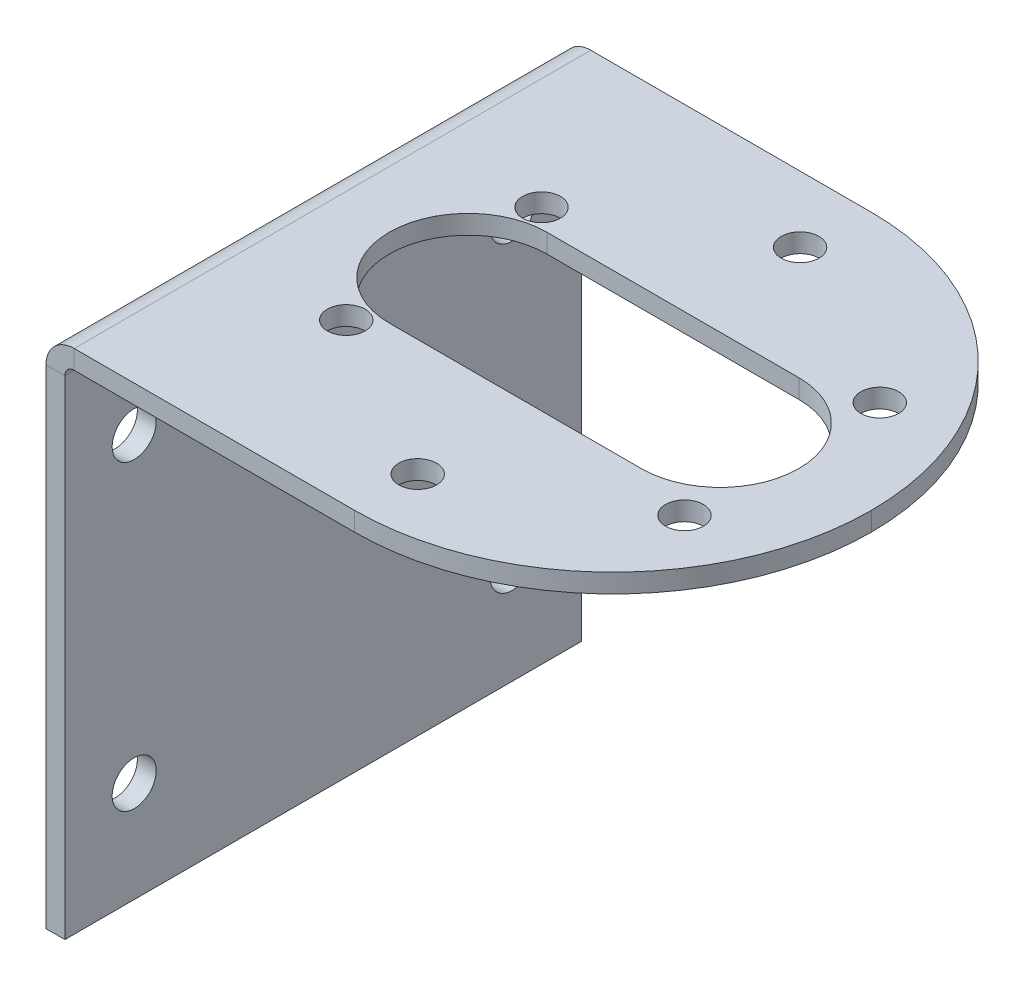
from build123d import *

# Parameters (mm, degrees)
SM_BASE_FLANGE_1_DEPTH = 20.5
FILLET_1_R             = 20.5
MM_1_D                 = 3
MM_1_DEPTH             = 7.5
MM_1_TIP               = 0.901290929
SKETCH_10_R            = 1.75
CUT_EXTRUDE_1_DEPTH    = 10
CUT_EXTRUDE_2_DEPTH    = 10


# Sheet-metal steps are written as plain solids
with BuildPart() as part:
    # Sketch 1 → 基体-法兰1 (new, symmetric)
    with BuildSketch(Plane.XY):
        with BuildLine():
            Line((0, 0), (0, 38.7634))
            ThreePointArc((0, 38.7634), (0.655084973, 40.344915027), (2.2366, 41))
            Line((2.2366, 41), (45, 41))
            Line((45, 41), (45, 39.5))
            Line((45, 39.5), (2.2366, 39.5))
            ThreePointArc((2.2366, 39.5), (1.715745145, 39.284254855), (1.5, 38.7634))
            Line((1.5, 38.7634), (1.5, 0))
            Line((1.5, 0), (0, 0))
        make_face()
    extrude(amount=SM_BASE_FLANGE_1_DEPTH, both=True)

    # 圆角1
    fillet_1_edges = [part.edges().sort_by_distance(p)[0] for p in [
        (45, 40.25, -20.5),
        (45, 40.25, 20.5),
    ]]
    fillet(fillet_1_edges, radius=FILLET_1_R - 0.0001)  # a hair under: the kernel refuses the full size

    # 大小mm 暗销孔1
    with Locations(Plane(origin=(0, 41, 0), x_dir=(1, 0, 0), z_dir=(0, 1, 0))):
        with Locations((24.087127043, 15.261627687), (37.923393759, 7.75), (37.923393759, -7.75), (24.5, -15.5), (11.076606241, -7.75), (11.076606241, 7.75)):
            Hole(MM_1_D / 2, depth=MM_1_DEPTH)
            with Locations((0, 0, -(MM_1_DEPTH + MM_1_TIP / 2))):  # 118° drill point
                Cone(0, MM_1_D / 2, MM_1_TIP, mode=Mode.SUBTRACT)

    # 草图10 → 切除-拉伸1 (cut)
    with BuildSketch(Plane.ZY):
        with Locations((-15, 32)):
            Circle(SKETCH_10_R)
        with Locations((15, 32)):
            Circle(SKETCH_10_R)
        with Locations((15, 8)):
            Circle(SKETCH_10_R)
        with Locations((-15, 8)):
            Circle(SKETCH_10_R)
    extrude(amount=-CUT_EXTRUDE_1_DEPTH, mode=Mode.SUBTRACT)

    # 草图11 → 切除-拉伸2 (cut)
    with BuildSketch(Plane.XZ.offset(-39.5)):
        with BuildLine():
            Line((33, -6.25), (13, -6.25))
            ThreePointArc((13, -6.25), (6.75, 0), (13, 6.25))
            Line((13, 6.25), (33, 6.25))
            ThreePointArc((33, 6.25), (39.25, 0), (33, -6.25))
        make_face()
    extrude(amount=-CUT_EXTRUDE_2_DEPTH, mode=Mode.SUBTRACT)


solid = part.part
